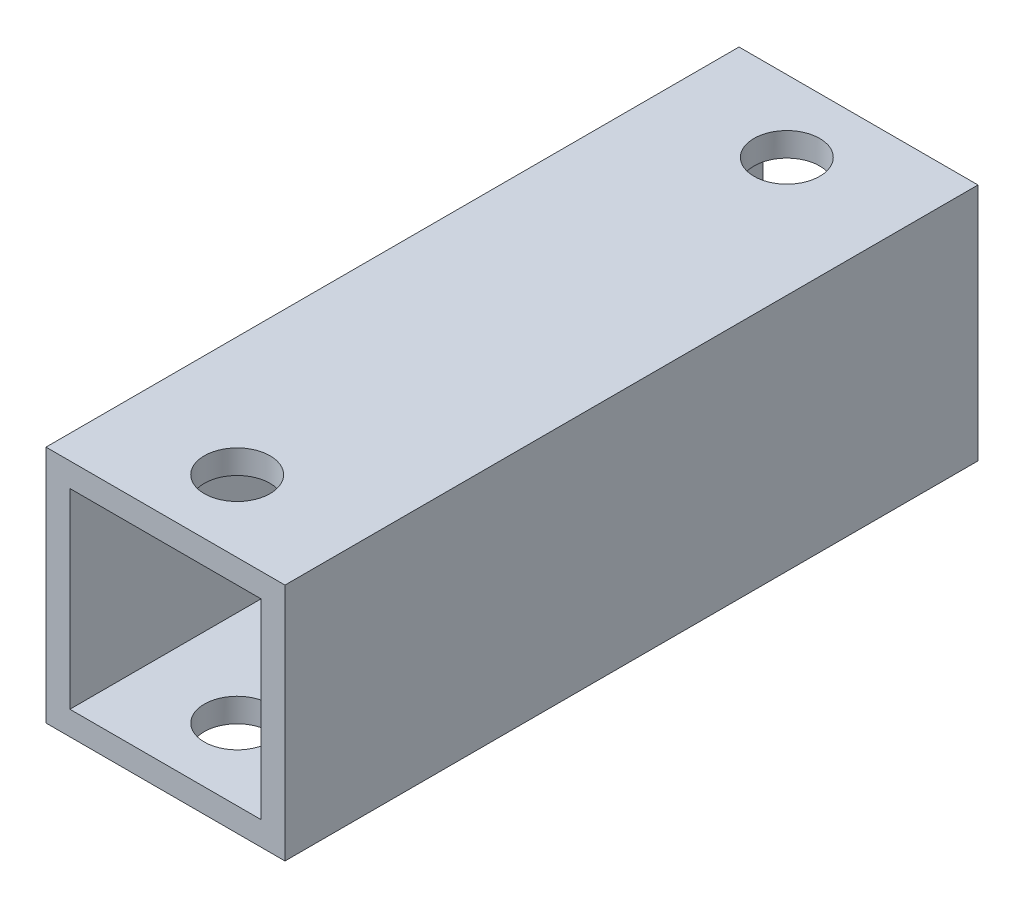
from build123d import *

# Parameters (mm, degrees)
SKETCH_1_W          = 20
SKETCH_1_H          = 20
SKETCH_1_W_2        = 16
SKETCH_1_H_2        = 16
EXTRUDE_1_DEPTH     = 58
SKETCH_2_R          = 2.75
CUT_EXTRUDE_1_DEPTH = 63.161081072


with BuildPart() as part:
    # 草图1 → 凸台-拉伸1 (new body)
    with BuildSketch(Plane.XY):
        Rectangle(SKETCH_1_W, SKETCH_1_H)
        Rectangle(SKETCH_1_W_2, SKETCH_1_H_2, mode=Mode.SUBTRACT)
    extrude(amount=EXTRUDE_1_DEPTH)

    # 草图2 → 切除-拉伸1 (cut, through all)
    with BuildSketch(Plane(origin=(0, 10, 0), x_dir=(1, 0, 0), z_dir=(0, 1, 0))):
        with Locations((0, -6)):
            Circle(SKETCH_2_R)
        with Locations((0, -52)):
            Circle(SKETCH_2_R)
    extrude(amount=-CUT_EXTRUDE_1_DEPTH, mode=Mode.SUBTRACT)


solid = part.part
